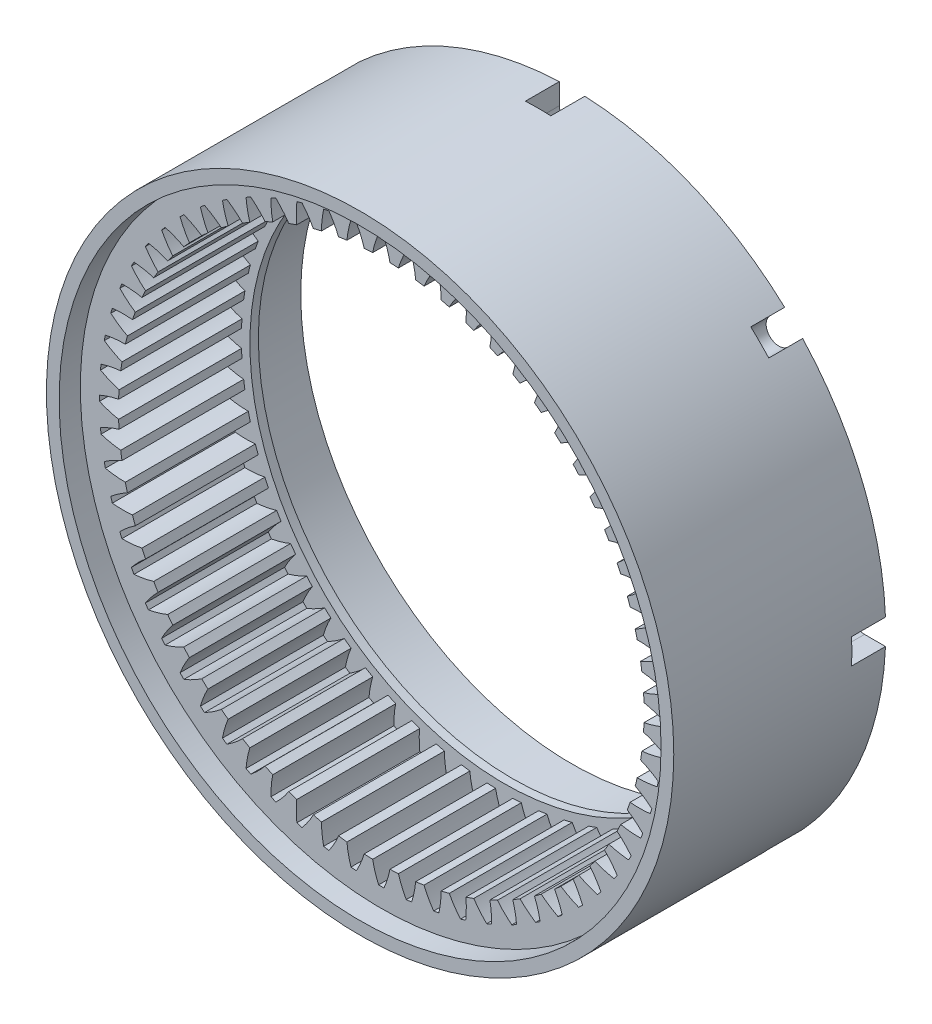
from build123d import *

# Parameters (mm, degrees)
SKETCH_1041_R               = 37
SKETCH_1041_R_2             = 31
EXTRUDE_1049_DEPTH          = 8.5
CUT_EXTRUDE_1573_DEPTH      = 8.5
PATTERN_CIRCULAR_1624_COUNT = 64
SKETCH_1_R                  = 35.5
CUT_EXTRUDE_1_DEPTH         = 2.5
SKETCH_2_R                  = 37
EXTRUDE_1_DEPTH             = 8
SKETCH_3_R                  = 30
CUT_EXTRUDE_2_DEPTH         = 8
SKETCH_4_R                  = 32
CUT_EXTRUDE_3_DEPTH         = 7
SKETCH_5_OUTSIDE_W          = 97.52
SKETCH_5_OUTSIDE_H          = 97.52
SKETCH_5_OUTSIDE_R          = 33
CUT_EXTRUDE_4_DEPTH         = 4
SKETCH_6_R                  = 37
SKETCH_6_R_2                = 36
EXTRUDE_1_2_DEPTH           = 4
EXTRUDE_2_DEPTH             = 4
CUT_EXTRUDE_5_DEPTH         = 4
PATTERN_CIRCULAR_1_COUNT    = 8


with BuildPart() as part:
    # Sketch 1041 → Extrude 1049 (new, symmetric)
    with BuildSketch(Plane.XY):
        Circle(SKETCH_1041_R)
        Circle(SKETCH_1041_R_2, mode=Mode.SUBTRACT)
    extrude(amount=EXTRUDE_1049_DEPTH, both=True)

    # Sketch 1165 → Cut-Extrude 1573 (cut, symmetric)
    with BuildSketch(Plane.XY):
        with BuildLine():
            add(Edge.make_bspline(
                [(-1.021977257, 30.983149654), (-1.004433331, 31.079598858), (-0.964914518, 31.277263961), (-0.872053267, 31.675256494), (-0.704535393, 32.245665633), (-0.537855207, 32.713177814), (-0.391617072, 33.077528358), (-0.319505513, 33.24846487)],
                knots=[0.005737947, 0.005737947, 0.005737947, 0.005737947, 0.005737947, 0.008132613, 0.010661158, 0.015718248, 0.020250124, 0.020250124, 0.020250124, 0.020250124, 0.020250124], degree=4))
            ThreePointArc((-1.021977257, 30.983149654), (0, 31), (1.021977257, 30.983149654))
            add(Edge.make_bspline(
                [(1.021977257, 30.983149654), (1.004433331, 31.079598858), (0.964914518, 31.277263961), (0.872053267, 31.675256494), (0.704535393, 32.245665633), (0.537855207, 32.713177814), (0.391617072, 33.077528358), (0.319505513, 33.24846487)],
                knots=[0.005737947, 0.005737947, 0.005737947, 0.005737947, 0.005737947, 0.008132613, 0.010661158, 0.015718248, 0.020250124, 0.020250124, 0.020250124, 0.020250124, 0.020250124], degree=4))
            ThreePointArc((0.319505513, 33.24846487), (0, 33.25), (-0.319505513, 33.24846487))
        make_face()
    cut_extrude_1573 = extrude(amount=CUT_EXTRUDE_1573_DEPTH, both=True, mode=Mode.SUBTRACT)

    # Pattern Circular 1624: Cut-Extrude 1573 ×64 about axis
    pattern_circular_1624_axis = Axis((0, 0, 8.5), (0, 0, -1))
    for i in range(1, PATTERN_CIRCULAR_1624_COUNT):
        add(cut_extrude_1573.rotate(pattern_circular_1624_axis, i * 360 / PATTERN_CIRCULAR_1624_COUNT), mode=Mode.SUBTRACT)

    # 草图1 → 切除-拉伸1 (cut)
    with BuildSketch(Plane.XY.offset(8.5)):
        Circle(SKETCH_1_R)
    extrude(amount=-CUT_EXTRUDE_1_DEPTH, mode=Mode.SUBTRACT)

    # 草图2 → Extrude 1 (add)
    with BuildSketch(Plane(origin=(0, 0, -8.5), x_dir=(-1, 0, 0), z_dir=(0, 0, -1))):
        Circle(SKETCH_2_R)
    extrude(amount=EXTRUDE_1_DEPTH)

    # 草图3 → 切除-拉伸2 (cut)
    with BuildSketch(Plane.XY.offset(-8.5)):
        Circle(SKETCH_3_R)
    extrude(amount=-CUT_EXTRUDE_2_DEPTH, mode=Mode.SUBTRACT)

    # 草图4 → 切除-拉伸3 (cut)
    with BuildSketch(Plane(origin=(0, 0, -16.5), x_dir=(-1, 0, 0), z_dir=(0, 0, -1))):
        Circle(SKETCH_4_R)
    extrude(amount=-CUT_EXTRUDE_3_DEPTH, mode=Mode.SUBTRACT)

    # 草图5 outside → 切除-拉伸4 (cut)
    with BuildSketch(Plane(origin=(0, 0, -16.5), x_dir=(-1, 0, 0), z_dir=(0, 0, -1))):
        Rectangle(SKETCH_5_OUTSIDE_W, SKETCH_5_OUTSIDE_H)
        Circle(SKETCH_5_OUTSIDE_R, mode=Mode.SUBTRACT)
    extrude(amount=-CUT_EXTRUDE_4_DEPTH, mode=Mode.SUBTRACT)

    # 草图6 → Extrude 1 2 (add)
    with BuildSketch(Plane(origin=(0, 0, -12.5), x_dir=(-1, 0, 0), z_dir=(0, 0, -1))):
        Circle(SKETCH_6_R)
        Circle(SKETCH_6_R_2, mode=Mode.SUBTRACT)
    extrude(amount=EXTRUDE_1_2_DEPTH)

    # 草图7 → 凸台-拉伸2 (add)
    with BuildSketch(Plane(origin=(0, 0, -12.5), x_dir=(-1, 0, 0), z_dir=(0, 0, -1))):
        with BuildLine():
            Line((2.5, 34.5), (2.5, 35.913089536))
            ThreePointArc((2.5, 35.913089536), (0, 36), (-2.5, 35.913089536))
            Line((-2.5, 35.913089536), (-2.5, 34.5))
            ThreePointArc((-2.5, 34.5), (-2.359867411, 33.674757124), (-1.955179357, 32.942028986))
            ThreePointArc((-1.955179357, 32.942028986), (0, 33), (1.955179357, 32.942028986))
            ThreePointArc((1.955179357, 32.942028986), (2.359867411, 33.674757124), (2.5, 34.5))
        make_face()
    extrude_2 = extrude(amount=EXTRUDE_2_DEPTH)

    # 草图8 → 切除-拉伸5 (cut)
    with BuildSketch(Plane(origin=(0, 0, -16.5), x_dir=(-1, 0, 0), z_dir=(0, 0, -1))):
        with BuildLine():
            Line((1.5, 34.5), (1.5, 37))
            ThreePointArc((1.5, 37), (0, 38.5), (-1.5, 37))
            Line((-1.5, 37), (-1.5, 34.5))
            ThreePointArc((-1.5, 34.5), (0, 33), (1.5, 34.5))
        make_face()
    cut_extrude_5 = extrude(amount=-CUT_EXTRUDE_5_DEPTH, mode=Mode.SUBTRACT)

    # 阵列(圆周)1: 凸台-拉伸2, 切除-拉伸5 ×8 about axis
    pattern_circular_1_axis = Axis((0, 0, -16.5), (0, 0, -1))
    add([extrude_2.rotate(pattern_circular_1_axis, i * 360 / PATTERN_CIRCULAR_1_COUNT) for i in range(1, PATTERN_CIRCULAR_1_COUNT)])
    add([cut_extrude_5.rotate(pattern_circular_1_axis, i * 360 / PATTERN_CIRCULAR_1_COUNT) for i in range(1, PATTERN_CIRCULAR_1_COUNT)], mode=Mode.SUBTRACT)


solid = part.part
